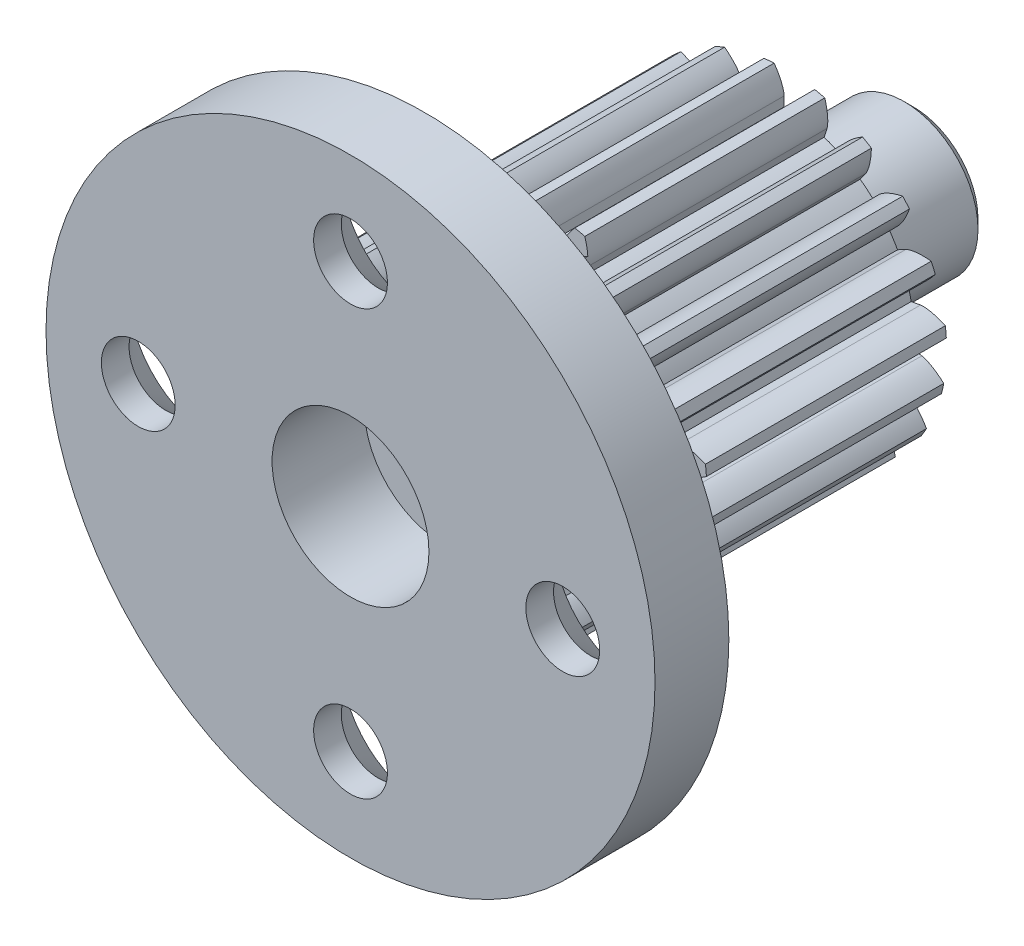
from build123d import *

# Parameters (mm, degrees)
SKETCH1_R           = 8.8
BOSS_EXTRUDE1_DEPTH = 9.75
CUT_EXTRUDE1_DEPTH  = 16.80956988662247
CIRPATTERN2_COUNT   = 20
CHAMFER1_SIZE       = 0.5
CHAMFER2_SIZE       = 0.5
SKETCH4_R           = 2.5
CUT_EXTRUDE2_DEPTH  = 39.402473964576814
SKETCH5_R           = 4.25
CUT_EXTRUDE3_DEPTH  = 5
SKETCH6_R           = 2
SKETCH6_R_2         = 1.9999999999999996
CUT_EXTRUDE4_DEPTH  = 36.309347297847346
CIRPATTERN3_COUNT   = 4
SKETCH8_R           = 4.5
SKETCH8_R_2         = 4.500000000000001
CUT_EXTRUDE5_DEPTH  = 6.5


with BuildPart() as part:
    # Sketch1 → Boss-Extrude1 (new, symmetric)
    with BuildSketch(Plane.XY):
        Circle(SKETCH1_R)
    extrude(amount=BOSS_EXTRUDE1_DEPTH, both=True)

    # Sketch2 → Cut-Extrude1 (cut, symmetric)
    with BuildSketch(Plane.XY):
        with BuildLine():
            add(Edge.make_bspline(
                [(7.517540966287267, 0), (7.520110866708064, 3.697278411484e-05), (7.527316988044233, 0.00025516849437089), (7.549556806339448, 0.00166762296979139), (7.593331739402326, 0.00653119652503209), (7.647158847839554, 0.01551170924606528), (7.708756635261055, 0.02867101269465142), (7.767907562216142, 0.04359454677791173), (7.818276462045496, 0.05772874611177531), (7.868310581554778, 0.07310327790415132), (7.917948492159066, 0.0895660424849033), (7.977812878871355, 0.1108577462916486), (8.049216207682885, 0.13826222948881114), (8.132064495868066, 0.1730061699499254), (8.225261451631324, 0.21559950195461527), (8.31934687768635, 0.26238914275803843), (8.411162907448706, 0.31119897040108835), (8.502976334983792, 0.3636652458286479), (8.59112899541961, 0.4166600780142432), (8.674672150948917, 0.47041627730737856), (8.731059450555389, 0.5078888913036268), (8.767993640518084, 0.533390395266864), (8.783169443024494, 0.5439986536029677)],
                knots=[0, 0, 0, 0, 0, 0.00537674862614496, 0.01508368816988055, 0.04661013955240243, 0.09211052548719963, 0.11947617586779116, 0.14684249576846414, 0.1742088538870799, 0.201574955629501, 0.22894101319225185, 0.2563073451901878, 0.3070350321649608, 0.3617673517707386, 0.41649966071787375, 0.4712319366918095, 0.5259642819310837, 0.5806966155459512, 0.6354289822487561, 0.6901613872332595, 0.7280749968168504, 0.7280749968168504, 0.7280749968168504, 0.7280749968168504, 0.7280749968168504], degree=4))
            Line((7.517540966287267, 0), (7, 0))
            ThreePointArc((7, -1.71e-15), (6.985831643229987, -0.44514745023039903), (6.943383927872393, -0.8884928982064746))
            Line((6.943383927872394, -0.8884928982064723), (7.456739017491617, -0.9541831086460635))
            add(Edge.make_bspline(
                [(7.4567390174916195, -0.9541831086460634), (7.459283439666169, -0.9545459735757729), (7.466403582770318, -0.9556770598927099), (7.488284245790196, -0.9599009362235743), (7.531087805234263, -0.9702814184523688), (7.583339684924586, -0.9860214400621533), (7.642768990569706, -1.0068927675959174), (7.699547296496782, -1.0292034826277108), (7.747714792755213, -1.0496165658101342), (7.795392784031863, -1.071217456781249), (7.842539644215671, -1.093847489074389), (7.899217343205462, -1.1225654257112856), (7.966564777057653, -1.1588113112455627), (8.044333023955163, -1.2037899731698565), (8.131369934208747, -1.2578680717706654), (8.21875550157375, -1.316221310745009), (8.303633610166434, -1.3762903483398619), (8.388045033594626, -1.4399859300376183), (8.46875820982767, -1.5037411412965747), (8.544802524410278, -1.5676664885218703), (8.59597745561188, -1.6119931258084506), (8.629376077870585, -1.6419763398423912), (8.643082658016503, -1.6544250260116742)],
                knots=[0, 0, 0, 0, 0, 0.00537674862614445, 0.01508368816988041, 0.04661013955240261, 0.09211052548719989, 0.1194761758677911, 0.1468424957684644, 0.1742088538870796, 0.2015749556295012, 0.2289410131922521, 0.25630734519018794, 0.30703503216495975, 0.3617673517707386, 0.4164996607178728, 0.4712319366918089, 0.5259642819310841, 0.5806966155459516, 0.6354289822487563, 0.6901613872332594, 0.7280749968167778, 0.7280749968167778, 0.7280749968167778, 0.7280749968167778, 0.7280749968167778], degree=4))
            ThreePointArc((8.643082658016542, -1.6544250260116664), (8.76068283270618, -0.8309249693728202), (8.8, -2.16e-15))
            ThreePointArc((8.8, 0), (8.795791354352803, 0.272129474134082), (8.783169443024434, 0.5439986536029847))
        make_face()
    cut_extrude1 = extrude(amount=CUT_EXTRUDE1_DEPTH, both=True, mode=Mode.SUBTRACT)

    # CirPattern2: Cut-Extrude1 ×20 about axis
    cirpattern2_axis = Axis((0, 0, -9.75), (0, 0, 1))
    for i in range(1, CIRPATTERN2_COUNT):
        add(cut_extrude1.rotate(cirpattern2_axis, i * 360 / CIRPATTERN2_COUNT), mode=Mode.SUBTRACT)

    # Sketch3 → Revolve1 (revolve)
    with BuildSketch(Plane(origin=(0, 0, 0), x_dir=(1, 0, 0), z_dir=(0, 1, 0))):
        Polygon((1.19e-15, 9.75), (0, 16.749999999999993), (-4, 16.749999999999993), (-3.9999999999999982, 11.249999999999996), (-4.499999999999999, 11.249999999999996), (-4.499999999999999, 9.75), align=None)
        Polygon((5.2e-15, -13.75), (4.52e-15, -9.75), (-16.499999999999996, -9.750000000000002), (-16.499999999999993, -13.750000000000002), align=None)
    revolve(axis=Axis((1.36e-15, 0, -9.75), (-1.2e-16, 0, -1)))

    # Chamfer1
    chamfer1_edges = [part.edges().sort_by_distance(p)[0] for p in [
        (4.500000000000003, 5.5e-16, -9.75),
    ]]
    chamfer(chamfer1_edges, length=CHAMFER1_SIZE)

    # Chamfer2
    chamfer2_edges = [part.edges().sort_by_distance(p)[0] for p in [
        (4.000000000000002, 4.9e-16, -16.749999999999993),
    ]]
    chamfer(chamfer2_edges, length=CHAMFER2_SIZE)

    # Sketch4 → Cut-Extrude2 (cut, through all)
    with BuildSketch(Plane.XY.offset(13.75)):
        Circle(SKETCH4_R)
    extrude(amount=-CUT_EXTRUDE2_DEPTH, mode=Mode.SUBTRACT)

    # Sketch5 → Cut-Extrude3 (cut)
    with BuildSketch(Plane.XY.offset(13.75)):
        Circle(SKETCH5_R)
    extrude(amount=-CUT_EXTRUDE3_DEPTH, mode=Mode.SUBTRACT)

    # Sketch6 → Cut-Extrude4 (cut, through all)
    with BuildSketch(Plane(origin=(1.2e-15, 0, 9.75), x_dir=(-1, 0, -1.65e-15), z_dir=(1.65e-15, 0, -1))):
        with Locations((0, 11.5)):
            Circle(SKETCH6_R)
        with Locations((11.5, 7e-16)):
            Circle(SKETCH6_R_2)
        with Locations((1.41e-15, -11.5)):
            Circle(SKETCH6_R)
        with Locations((-11.5, -2.11e-15)):
            Circle(SKETCH6_R_2)
    extrude(amount=-CUT_EXTRUDE4_DEPTH, mode=Mode.SUBTRACT)

    # Sketch7 → Cut-Revolve1 (revolve, cut)
    with BuildSketch(Plane(origin=(0, 0, 0), x_dir=(1, 0, 0), z_dir=(0, 1, 0))):
        Polygon((15.999999999999993, -9.750000000000016), (11.499999999999995, -9.750000000000016), (11.499999999999995, -12.250000000000016), (13.499999999999995, -12.250000000000016), align=None)
    cut_revolve1 = revolve(axis=Axis((11.499999999999995, 0, 9.750000000000016), (-4.3e-16, 0, 1)), mode=Mode.SUBTRACT)

    # CirPattern3: Cut-Revolve1 ×4 about axis
    cirpattern3_axis = Axis((1.511e-14, 0, -16.749999999999993), (0, 0, 1))
    for i in range(1, CIRPATTERN3_COUNT):
        add(cut_revolve1.rotate(cirpattern3_axis, i * 360 / CIRPATTERN3_COUNT), mode=Mode.SUBTRACT)

    # Sketch8 → Cut-Extrude5 (cut)
    with BuildSketch(Plane(origin=(1.2e-15, 0, 9.75), x_dir=(-1, 0, 1.2e-16), z_dir=(-1.2e-16, 0, -1))):
        with Locations((8.54e-15, 11.5)):
            Circle(SKETCH8_R)
        with Locations((11.5, -4.869e-14)):
            Circle(SKETCH8_R_2)
        with Locations((-8.884e-14, -11.5)):
            Circle(SKETCH8_R_2)
        with Locations((-11.499999999999998, 1.2899e-13)):
            Circle(SKETCH8_R)
    extrude(amount=CUT_EXTRUDE5_DEPTH, mode=Mode.SUBTRACT)


solid = part.part
